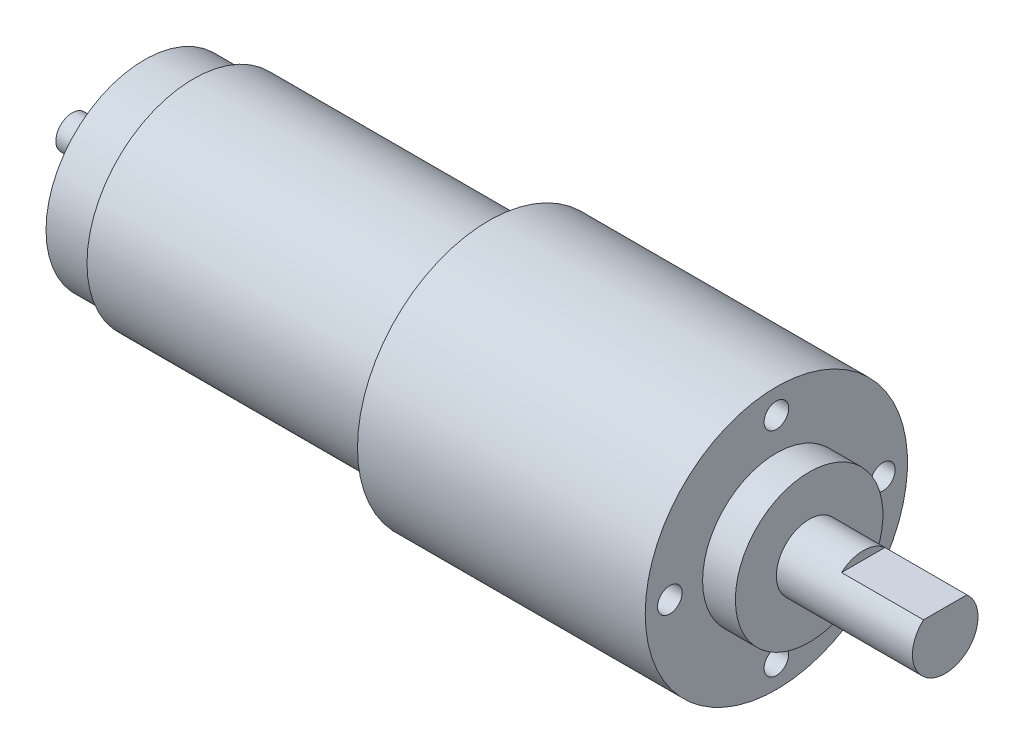
from build123d import *

# Parameters (mm, degrees)
ESQUISSE2_W                  = 5.291502622
ESQUISSE2_H                  = 1
ENL_V_MAT_EXTRU_1_DEPTH      = 10
ESQUISSE3_R                  = 1.5
ENL_V_MAT_EXTRU_2_DEPTH      = 3
R_P_TITION_CIRCULAIRE1_COUNT = 4


with BuildPart() as part:
    # Esquisse1 → Révolution1 (revolve)
    with BuildSketch(Plane.XY):
        Polygon((0, 0), (106.5, 0), (106.5, 4), (89.9, 4), (89.9, 9), (85.9, 9), (85.9, 16), (50.8, 16), (50.8, 13), (14.8, 13), (14.8, 12), (8.8, 12), (8.8, 2), (0, 2), align=None)
    revolve(axis=Axis((0, 0, 0), (1, 0, 0)))

    # Esquisse2 → Enlèv. mat.-Extru.1 (cut)
    with BuildSketch(Plane(origin=(106.5, 0, 0), x_dir=(0, 0, -1), z_dir=(1, 0, 0))):
        with Locations((0, 3.5)):
            Rectangle(ESQUISSE2_W, ESQUISSE2_H)
    extrude(amount=-ENL_V_MAT_EXTRU_1_DEPTH, mode=Mode.SUBTRACT)

    # Esquisse3 → Enlèv. mat.-Extru.2 (cut)
    with BuildSketch(Plane(origin=(85.9, 0, 0), x_dir=(0, 0, -1), z_dir=(1, 0, 0))):
        with Locations((0, 13)):
            Circle(ESQUISSE3_R)
    enl_v_mat_extru_2 = extrude(amount=-ENL_V_MAT_EXTRU_2_DEPTH, mode=Mode.SUBTRACT)

    # Répétition circulaire1: Enlèv. mat.-Extru.2 ×4 about axis
    r_p_tition_circulaire1_axis = Axis((-5.325, 0, 0), (1, 0, 0))
    for i in range(1, R_P_TITION_CIRCULAIRE1_COUNT):
        add(enl_v_mat_extru_2.rotate(r_p_tition_circulaire1_axis, i * 360 / R_P_TITION_CIRCULAIRE1_COUNT), mode=Mode.SUBTRACT)


solid = part.part
